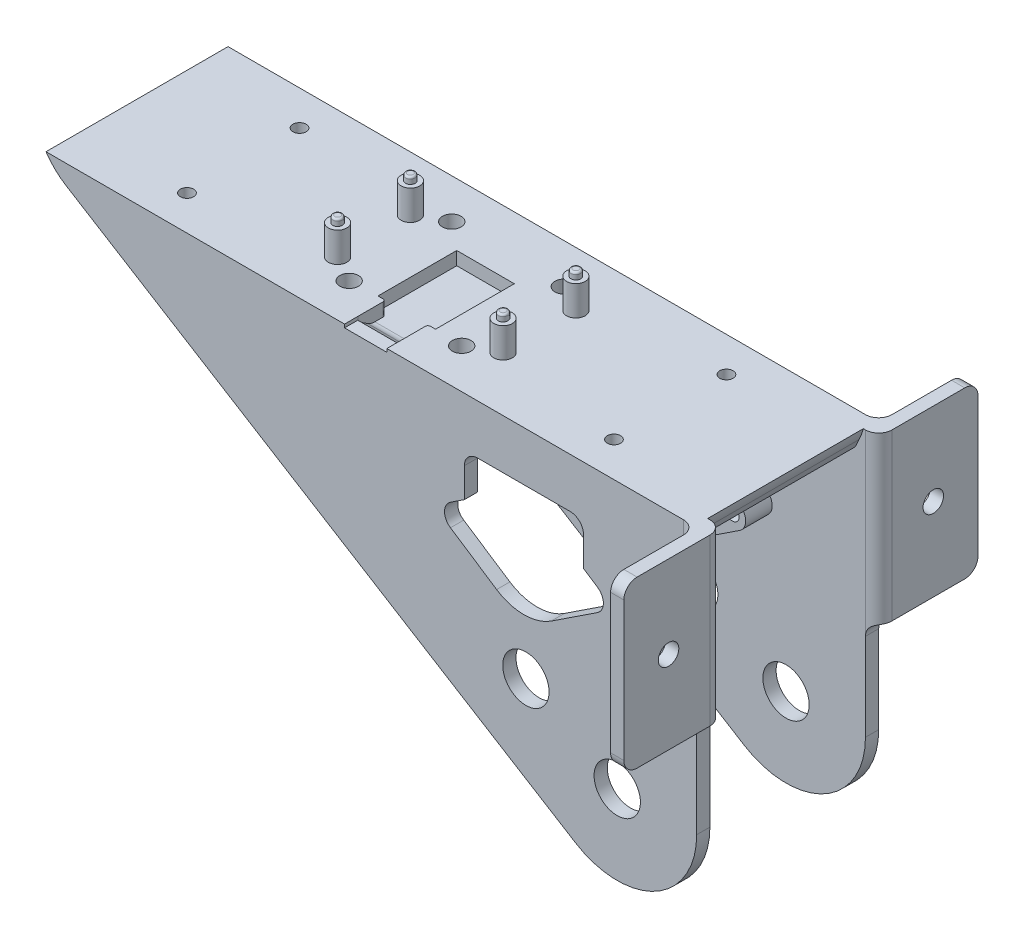
from build123d import *

# Parameters (mm, degrees)
SKETCH_1_W           = 100
SKETCH_1_H           = 25.5
EXTRUDE_1_DEPTH      = 3
EXTRUDE_2_DEPTH      = 1.5
SKETCH_5_R           = 1.4
EXTRUDE_3_DEPTH      = 4.5
SKETCH_6_R           = 0.725
EXTRUDE_4_DEPTH      = 1
SKETCH_7_R           = 1
CUT_EXTRUDE_1_DEPTH  = 10
SKETCH_8_R           = 2
CUT_EXTRUDE_2_DEPTH  = 1
FILLET_1_R           = 2
SKETCH_9_R           = 2.65
EXTRUDE_5_DEPTH      = 3.5
SKETCH_11_R          = 1.05
CUT_EXTRUDE_4_DEPTH  = 100
SKETCH_12_R          = 1.41
CUT_EXTRUDE_5_DEPTH  = 5.5
FILLET_2_R           = 0.3
CUT_EXTRUDE_8_DEPTH  = 2
CUT_EXTRUDE_9_DEPTH  = 1.5
EXTRUDE_6_DEPTH      = 6.4
FILLET_3_R           = 2
FILLET_5_R           = 1
FILLET_6_R           = 0.4
SKETCH_23_R          = 2.838964553
CUT_EXTRUDE_11_DEPTH = 5
EXTRUDE_12_DEPTH     = 1
CUT_EXTRUDE_20_DEPTH = 27.5
CUT_EXTRUDE_21_DEPTH = 23.5
CUT_EXTRUDE_22_DEPTH = 30
SKETCH_38_R          = 3.5
CUT_EXTRUDE_23_DEPTH = 50
SKETCH_40_R          = 3.5
CUT_EXTRUDE_24_DEPTH = 50
SKETCH_41_R          = 3.5
CUT_EXTRUDE_25_DEPTH = 50
CUT_EXTRUDE_26_DEPTH = 20
EXTRUDE_START        = 4
SKETCH_45_R          = 4
EXTRUDE_13_DEPTH     = 4
SKETCH_47_R          = 1
CUT_EXTRUDE_29_DEPTH = 4
SKETCH_48_W          = 6.396363923
SKETCH_48_H          = 0.5
CUT_EXTRUDE_30_DEPTH = 5
CUT_EXTRUDE_31_DEPTH = 10
SKETCH_50_W          = 15
SKETCH_50_H          = 25
SKETCH_50_R          = 1.55
EXTRUDE_14_DEPTH     = 2
FILLET_8_R           = 2
FILLET_9_R           = 2
FILLET_10_R          = 2


with BuildPart() as part:
    # 草图1 → 凸台-拉伸1 (new body)
    with BuildSketch(Plane(origin=(0, 0, 0), x_dir=(1, 0, 0), z_dir=(0, 1, 0))):
        Rectangle(SKETCH_1_W, SKETCH_1_H)
    extrude(amount=EXTRUDE_1_DEPTH)

    # 草图2 → 凸台-拉伸2 (add)
    with BuildSketch(Plane(origin=(0, 3, 0), x_dir=(1, 0, 0), z_dir=(0, 1, 0))):
        Polygon((-5.35, 5.35), (5.35, 5.35), (5.35, -7.55), (4.35, -7.55), (4.35, 4.35), (-4.35, 4.35), (-4.35, -7.55), (-5.35, -7.55), align=None)
    extrude(amount=EXTRUDE_2_DEPTH)

    # 草图5 → 凸台-拉伸3 (add)
    with BuildSketch(Plane(origin=(0, 3, 0), x_dir=(1, 0, 0), z_dir=(0, 1, 0))):
        with Locations(Location((12.5, 5.5, 0), (0, 0, 270))):
            Circle(SKETCH_5_R)
        with Locations(Location((12.5, -5.5, 0), (0, 0, 90))):
            Circle(SKETCH_5_R)
        with Locations(Location((-12.5, -5.5, 0), (0, 0, 270))):
            Circle(SKETCH_5_R)
        with Locations(Location((-12.5, 5.5, 0), (0, 0, 90))):
            Circle(SKETCH_5_R)
    extrude(amount=EXTRUDE_3_DEPTH)

    # 草图6 → 凸台-拉伸4 (add)
    with BuildSketch(Plane(origin=(0, 7.5, 0), x_dir=(1, 0, 0), z_dir=(0, 1, 0))):
        with Locations(Location((-12.5, -5.5, 0), (0, 0, 270))):
            Circle(SKETCH_6_R)
        with Locations(Location((-12.5, 5.5, 0), (0, 0, 270))):
            Circle(SKETCH_6_R)
        with Locations(Location((12.5, 5.5, 0), (0, 0, 270))):
            Circle(SKETCH_6_R)
        with Locations(Location((12.5, -5.5, 0), (0, 0, 270))):
            Circle(SKETCH_6_R)
    extrude(amount=EXTRUDE_4_DEPTH)

    # 草图7 → 切除-拉伸1 (cut)
    with BuildSketch(Plane(origin=(0, 3, 0), x_dir=(1, 0, 0), z_dir=(0, 1, 0))):
        with Locations(Location((32.25, 8.5, 0), (0, 0, 270))):
            Circle(SKETCH_7_R)
        with Locations(Location((-32.25, 8.5, 0), (0, 0, 270))):
            Circle(SKETCH_7_R)
        with Locations(Location((-32.25, -8.5, 0), (0, 0, 270))):
            Circle(SKETCH_7_R)
        with Locations(Location((32.25, -8.5, 0), (0, 0, 270))):
            Circle(SKETCH_7_R)
    extrude(amount=-CUT_EXTRUDE_1_DEPTH, mode=Mode.SUBTRACT)

    # 草图8 → 切除-拉伸2 (cut)
    with BuildSketch(Plane.XZ):
        with Locations(Location((-32.25, 8.5, 0), (0, 0, 270))):
            Circle(SKETCH_8_R)
        with Locations(Location((32.25, 8.5, 0), (0, 0, 270))):
            Circle(SKETCH_8_R)
        with Locations(Location((32.25, -8.5, 0), (0, 0, 270))):
            Circle(SKETCH_8_R)
        with Locations(Location((-32.25, -8.5, 0), (0, 0, 270))):
            Circle(SKETCH_8_R)
    extrude(amount=-CUT_EXTRUDE_2_DEPTH, mode=Mode.SUBTRACT)

    # 圆角1
    fillet_1_edges = [part.edges().sort_by_distance(p)[0] for p in [
        (50, 1.5, 12.75),
        (-50, 1.5, 12.75),
        (-50, 1.5, -12.75),
        (50, 1.5, -12.75),
    ]]
    fillet(fillet_1_edges, radius=FILLET_1_R)

    # 草图9 → 凸台-拉伸5 (add)
    with BuildSketch(Plane(origin=(0, 3, 0), x_dir=(1, 0, 0), z_dir=(0, 1, 0))):
        with Locations(Location((8.5, 7.75, 0), (0, 0, 270))):
            Circle(SKETCH_9_R)
        with Locations(Location((-8.5, 7.75, 0), (0, 0, 90))):
            Circle(SKETCH_9_R)
        with Locations(Location((-8.5, -7.75, 0), (0, 0, 270))):
            Circle(SKETCH_9_R)
        with Locations(Location((8.5, -7.75, 0), (0, 0, 90))):
            Circle(SKETCH_9_R)
    extrude(amount=EXTRUDE_5_DEPTH)

    # 草图11 → 切除-拉伸4 (cut)
    with BuildSketch(Plane(origin=(0, 6.5, 0), x_dir=(1, 0, 0), z_dir=(0, 1, 0))):
        with Locations(Location((-8.5, 7.75, 0), (0, 0, 270))):
            Circle(SKETCH_11_R)
        with Locations(Location((-8.5, -7.75, 0), (0, 0, 270))):
            Circle(SKETCH_11_R)
        with Locations(Location((8.5, -7.75, 0), (0, 0, 270))):
            Circle(SKETCH_11_R)
        with Locations(Location((8.5, 7.75, 0), (0, 0, 270))):
            Circle(SKETCH_11_R)
    extrude(amount=-CUT_EXTRUDE_4_DEPTH, mode=Mode.SUBTRACT)

    # 草图12 → 切除-拉伸5 (cut)
    with BuildSketch(Plane(origin=(0, 6.5, 0), x_dir=(1, 0, 0), z_dir=(0, 1, 0))):
        with Locations(Location((-8.5, 7.75, 0), (0, 0, 270))):
            Circle(SKETCH_12_R)
        with Locations(Location((8.5, 7.75, 0), (0, 0, 270))):
            Circle(SKETCH_12_R)
        with Locations(Location((-8.5, -7.75, 0), (0, 0, 270))):
            Circle(SKETCH_12_R)
        with Locations(Location((8.5, -7.75, 0), (0, 0, 270))):
            Circle(SKETCH_12_R)
    extrude(amount=-CUT_EXTRUDE_5_DEPTH, mode=Mode.SUBTRACT)

    # 圆角2
    fillet_2_edges = [part.edges().sort_by_distance(p)[0] for p in [
        (-12.5, 8.5, 4.775),
        (-12.5, 8.5, -6.225),
        (12.5, 8.5, -6.225),
        (12.5, 8.5, 4.775),
    ]]
    fillet(fillet_2_edges, radius=FILLET_2_R)

    # 草图15 → 切除-拉伸8 (cut)
    with BuildSketch(Plane(origin=(0, 3, 0), x_dir=(1, 0, 0), z_dir=(0, 1, 0))):
        Polygon((-4.35, 4.35), (4.35, 4.35), (4.35, -7.55), (3.2, -7.55), (3.2, -12.75), (-3.2, -12.75), (-3.2, -7.55), (-4.35, -7.55), align=None)
    extrude(amount=-CUT_EXTRUDE_8_DEPTH, mode=Mode.SUBTRACT)

    # 草图17 → 切除-拉伸9 (cut)
    with BuildSketch(Plane(origin=(0, 4.5, 0), x_dir=(1, 0, 0), z_dir=(0, 1, 0))):
        Polygon((-4.35, -7.55), (-4.35, 4.35), (4.35, 4.35), (4.35, -7.55), (5.35, -7.55), (5.35, 5.35), (-5.35, 5.35), (-5.35, -7.55), align=None)
    extrude(amount=-CUT_EXTRUDE_9_DEPTH, mode=Mode.SUBTRACT)

    # 草图18 → 凸台-拉伸6 (add)
    with BuildSketch(Plane.ZY.offset(-3.2)):
        Polygon((12.75, 1), (9.75, 1), (12.25, 2.6), (12.75, 2.6), align=None)
    extrude(amount=EXTRUDE_6_DEPTH)

    # 圆角3
    fillet_3_edges = [part.edges().sort_by_distance(p)[0] for p in [
        (0, 1, 9.75),
    ]]
    fillet(fillet_3_edges, radius=FILLET_3_R)

    # 圆角5
    fillet_5_edges = [part.edges().sort_by_distance(p)[0] for p in [
        (0, 2.6, 12.25),
    ]]
    fillet(fillet_5_edges, radius=FILLET_5_R)

    # 圆角6
    fillet_6_edges = [part.edges().sort_by_distance(p)[0] for p in [
        (3.2, 2, 7.55),
        (-3.2, 2, 7.55),
    ]]
    fillet(fillet_6_edges, radius=FILLET_6_R)

    # 草图23 → 切除-拉伸11 (cut)
    with BuildSketch(Plane(origin=(0, 3, 0), x_dir=(1, 0, 0), z_dir=(0, 1, 0))):
        with Locations((-8.5, 7.75)):
            Circle(SKETCH_23_R)
        with Locations((8.5, 7.75)):
            Circle(SKETCH_23_R)
        with Locations((8.5, -7.75)):
            Circle(SKETCH_23_R)
        with Locations((-8.5, -7.75)):
            Circle(SKETCH_23_R)
    extrude(amount=CUT_EXTRUDE_11_DEPTH, mode=Mode.SUBTRACT)

    # 草图26 → 凸台-拉伸12 (add, symmetric)
    with BuildSketch(Plane(origin=(0, 0, -12.75), x_dir=(-1, 0, 0), z_dir=(0, 0, -1))):
        Polygon((50, 3), (-47.226468446, -57.009847793), (-50, -58.721719149), (-50, 3), align=None)
    extrude_12 = extrude(amount=EXTRUDE_12_DEPTH, both=True)

    # 镜向1: 凸台-拉伸12 across plane
    add(extrude_12.mirror(Plane.XY))

    # 草图34 → 切除-拉伸20 (cut)
    with BuildSketch(Plane(origin=(0, 0, -13.75), x_dir=(-1, 0, 0), z_dir=(0, 0, -1))):
        with BuildLine():
            Line((50, 15.008699923), (50, 8.579241028))
            ThreePointArc((50, 8.579241028), (48.73277753, 3.707013959), (45.252280679, 0.069626015))
            Line((45.252280679, 0.069626015), (38.344857738, -4.193754173))
            Line((38.344857738, -4.193754173), (52.839499898, -4.765435378))
            Line((52.839499898, -4.765435378), (50, 15.008699923))
        make_face()
    extrude(amount=-CUT_EXTRUDE_20_DEPTH, mode=Mode.SUBTRACT)

    # 草图35 → 切除-拉伸21 (cut)
    with BuildSketch(Plane.XY.offset(-11.75)):
        with BuildLine():
            Line((50, 10.630966152), (50, 5.53970897))
            ThreePointArc((50, 5.53970897), (49.755905436, 3.343733306), (49.035538177, 1.254962787))
            Line((49.035538177, 1.254962787), (33.740658756, -30.998398561))
            Line((33.740658756, -30.998398561), (57.072453739, -23.756268409))
            Line((57.072453739, -23.756268409), (50, 10.630966152))
        make_face()
    extrude(amount=CUT_EXTRUDE_21_DEPTH, mode=Mode.SUBTRACT)

    # 草图37 → 切除-拉伸22 (cut)
    with BuildSketch(Plane(origin=(0, 0, -13.75), x_dir=(-1, 0, 0), z_dir=(0, 0, -1))):
        with BuildLine():
            Line((-50, -58.721719149), (-31.697263185, -47.424955336))
            ThreePointArc((-31.697263185, -47.424955336), (-43.846672482, -47.692750357), (-50, -37.21341732))
            Line((-50, -37.21341732), (-50, -58.721719149))
        make_face()
    extrude(amount=-CUT_EXTRUDE_22_DEPTH, mode=Mode.SUBTRACT)

    # 草图38 → 切除-拉伸23 (cut)
    with BuildSketch(Plane.XY.offset(13.75)):
        with Locations((38, -37.21341732)):
            Circle(SKETCH_38_R)
    extrude(amount=-CUT_EXTRUDE_23_DEPTH, mode=Mode.SUBTRACT)

    # 草图40 → 切除-拉伸24 (cut)
    with BuildSketch(Plane.XY.offset(13.75)):
        with Locations((24.202306716, -29.69507016)):
            Circle(SKETCH_40_R)
    extrude(amount=-CUT_EXTRUDE_24_DEPTH, mode=Mode.SUBTRACT)

    # 草图41 → 切除-拉伸25 (cut)
    with BuildSketch(Plane.XY.offset(13.75)):
        with Locations((23.905158818, -13.977647254)):
            Circle(SKETCH_41_R)
    extrude(amount=-CUT_EXTRUDE_25_DEPTH, mode=Mode.SUBTRACT)

    # 草图43 → 切除-拉伸26 (cut)
    with BuildSketch(Plane.XY.offset(13.75)):
        with BuildLine():
            Line((28.030158818, -7.713912346), (35.005158818, -12.307317945))
            ThreePointArc((35.005158818, -12.307317945), (35.905158818, -13.977647254), (35.005158818, -15.647976563))
            Line((35.005158818, -15.647976563), (28.030158818, -20.241382162))
            ThreePointArc((28.030158818, -20.241382162), (23.905158818, -21.477647254), (19.780158818, -20.241382162))
            Line((19.780158818, -20.241382162), (12.805158818, -15.647976563))
            ThreePointArc((12.805158818, -15.647976563), (11.905158818, -13.977647254), (12.805158818, -12.307317945))
            Line((12.805158818, -12.307317945), (19.780158818, -7.713912346))
            ThreePointArc((19.780158818, -7.713912346), (23.905158818, -6.477647254), (28.030158818, -7.713912346))
        make_face()
    extrude(amount=-CUT_EXTRUDE_26_DEPTH, mode=Mode.SUBTRACT)

    # 草图45 → 凸台-拉伸13 (add)
    with BuildSketch(Plane.XY.offset(-11.75).offset(EXTRUDE_START)):
        with BuildLine():
            Line((19.780158818, -7.713912346), (12.805158818, -12.307317945))
            ThreePointArc((12.805158818, -12.307317945), (11.905158818, -13.977647254), (12.805158818, -15.647976563))
            Line((12.805158818, -15.647976563), (19.780158818, -20.241382162))
            ThreePointArc((19.780158818, -20.241382162), (23.905158818, -21.477647254), (28.030158818, -20.241382162))
            Line((28.030158818, -20.241382162), (35.005158818, -15.647976563))
            ThreePointArc((35.005158818, -15.647976563), (35.905158818, -13.977647254), (35.005158818, -12.307317945))
            Line((35.005158818, -12.307317945), (28.030158818, -7.713912346))
            ThreePointArc((28.030158818, -7.713912346), (23.905158818, -6.477647254), (19.780158818, -7.713912346))
        make_face()
        with Locations((23.905158818, -13.977647254)):
            Circle(SKETCH_45_R, mode=Mode.SUBTRACT)
    extrude(amount=-EXTRUDE_13_DEPTH)

    # 草图47 → 切除-拉伸29 (cut)
    with BuildSketch(Plane.XY.offset(-7.75)):
        with Locations((33.905158818, -13.977647254)):
            Circle(SKETCH_47_R)
        with Locations((13.905158818, -13.977647254)):
            Circle(SKETCH_47_R)
    extrude(amount=-CUT_EXTRUDE_29_DEPTH, mode=Mode.SUBTRACT)

    # 草图48 → 切除-拉伸30 (cut)
    with BuildSketch(Plane.XY.offset(13.75)):
        with Locations((-0.000580626, 2.75)):
            Rectangle(SKETCH_48_W, SKETCH_48_H)
    extrude(amount=-CUT_EXTRUDE_30_DEPTH, mode=Mode.SUBTRACT)

    # 草图49 → 切除-拉伸31 (cut)
    with BuildSketch(Plane.XY.offset(13.75)):
        with BuildLine():
            Line((16.905158818, -4.477647254), (30.905158818, -4.477647254))
            ThreePointArc((30.905158818, -4.477647254), (32.31937238, -5.063433692), (32.905158818, -6.477647254))
            Line((32.905158818, -6.477647254), (32.905158818, -11.477647254))
            Line((32.905158818, -11.477647254), (14.905158818, -11.477647254))
            Line((14.905158818, -11.477647254), (14.905158818, -6.477647254))
            ThreePointArc((14.905158818, -6.477647254), (15.490945255, -5.063433692), (16.905158818, -4.477647254))
        make_face()
    extrude(amount=-CUT_EXTRUDE_31_DEPTH, mode=Mode.SUBTRACT)

    # 草图50 → 凸台-拉伸14 (add)
    # profile 1 of 2: a face of its own
    with BuildSketch(Plane(origin=(50, 0, 0), x_dir=(0, 0, -1), z_dir=(1, 0, 0))):
        with Locations((19.25, -9.5)):
            Rectangle(SKETCH_50_W, SKETCH_50_H)
        with Locations(Location((20, -9.5, 0), (0, 0, 270))):
            Circle(SKETCH_50_R, mode=Mode.SUBTRACT)
    # profile 2 of 2: a face of its own
    with BuildSketch(Plane(origin=(50, 0, 0), x_dir=(0, 0, -1), z_dir=(1, 0, 0))):
        with Locations((-19.25, -9.5)):
            Rectangle(SKETCH_50_W, SKETCH_50_H)
        with Locations(Location((-20, -9.5, 0), (0, 0, 90))):
            Circle(SKETCH_50_R, mode=Mode.SUBTRACT)
    extrude(amount=EXTRUDE_14_DEPTH)

    # 圆角8
    fillet_8_edges = [part.edges().sort_by_distance(p)[0] for p in [
        (50, -9.5, -13.75),
        (50, -9.5, 13.75),
        (51, -22, -26.75),
        (51, 3, -26.75),
        (51, 3, 26.75),
        (51, -22, 26.75),
    ]]
    fillet(fillet_8_edges, radius=FILLET_8_R)

    # 圆角9
    fillet_9_edges = [part.edges().sort_by_distance(p)[0] for p in [
        (50, -22, 12.75),
        (50, -22, -12.75),
    ]]
    fillet(fillet_9_edges, radius=FILLET_9_R - 0.0001)  # a hair under: the kernel refuses the full size

    # 圆角10
    fillet_10_edges = [part.edges().sort_by_distance(p)[0] for p in [
        (52, -9.5, -11.75),
        (52, -9.5, 11.75),
    ]]
    fillet(fillet_10_edges, radius=FILLET_10_R - 0.0001)  # a hair under: the kernel refuses the full size


solid = part.part
